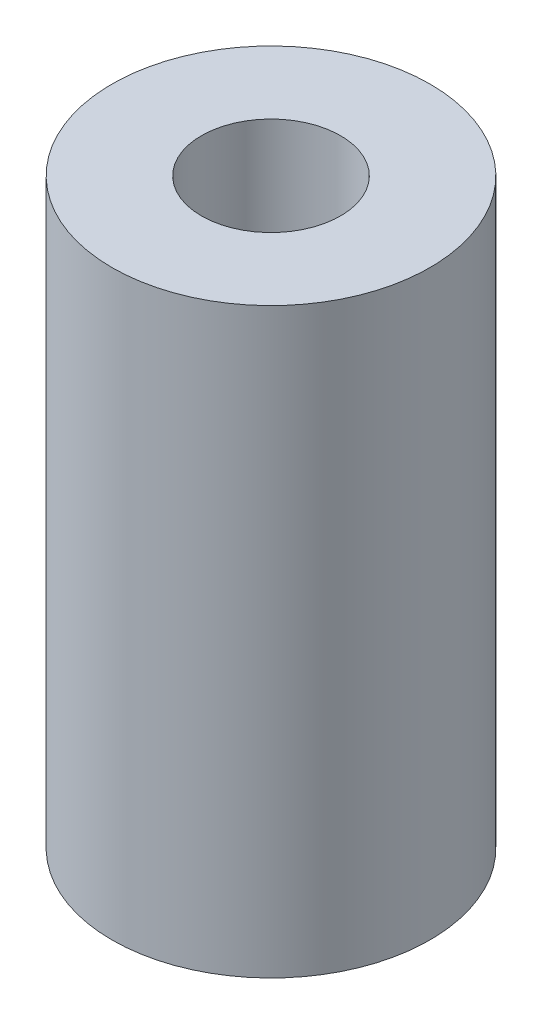
from build123d import *

# Parameters (mm, degrees)
SKETCH_1_R      = 4
SKETCH_1_R_2    = 1.75
EXTRUDE_1_DEPTH = 14.65


with BuildPart() as part:
    # 草图1 → 凸台-拉伸1 (new body)
    with BuildSketch(Plane(origin=(0, 0, 0), x_dir=(1, 0, 0), z_dir=(0, 1, 0))):
        Circle(SKETCH_1_R)
        Circle(SKETCH_1_R_2, mode=Mode.SUBTRACT)
    extrude(amount=EXTRUDE_1_DEPTH)


solid = part.part
